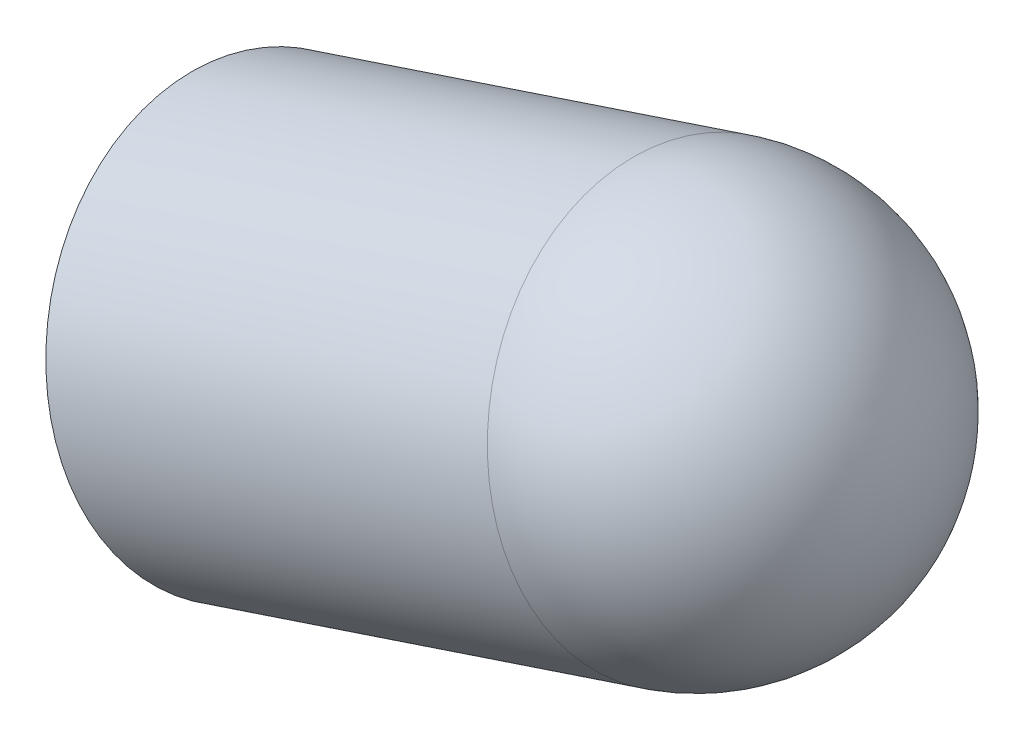
from build123d import *

# Parameters (mm, degrees)
SKETCH2_R           = 15
BOSS_EXTRUDE1_DEPTH = 50
FILLET1_R           = 15


# Read off the part's stored shape, not the designer's step: Bill Native-31-surface1
with BuildPart() as part:
    # Sketch2 → Boss-Extrude1 (new body)
    with BuildSketch(Plane(origin=(264.429040172, 87.865400929, 0), x_dir=(0, 0, 1), z_dir=(-0.9489817626112619, -0.31533095983620574, 0))):
        with Locations(Location((-83.594811233, 154.924883756, 0), (0, 0, 270))):
            Circle(SKETCH2_R)
    extrude(amount=-BOSS_EXTRUDE1_DEPTH)

    # Fillet1
    fillet1_edges = [part.edges().sort_by_distance(p)[0] for p in [
        (258.295551607, 264.887564618, -83.594811233),
    ]]
    fillet(fillet1_edges, radius=FILLET1_R)


solid = part.part
